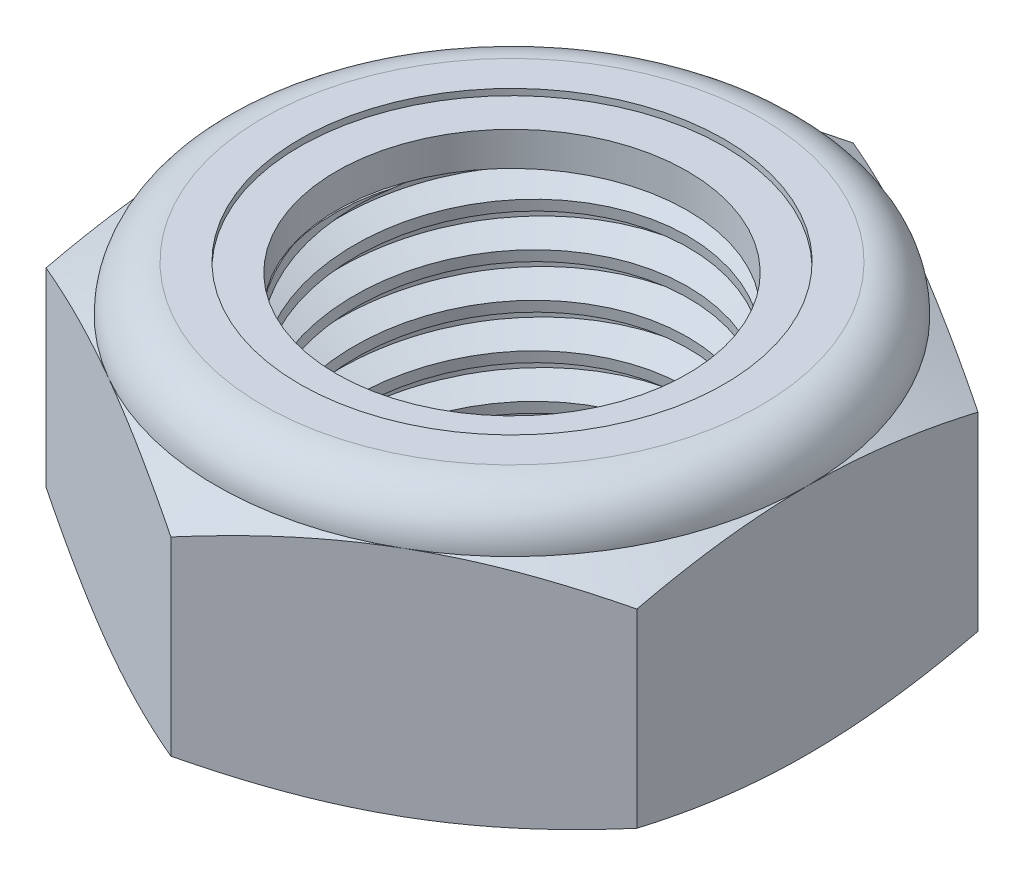
from build123d import *

# Parameters (mm, degrees)
EXTRUDE1_DEPTH       = 6.746875
SKETCH2_W            = 4.7625
SKETCH2_H            = 6.746875
LPATTERN1_COUNT      = 6
LPATTERN1_PITCH      = 1.058333333
LPATTERN1_COUNT_DIR2 = 2
LPATTERN1_PITCH_DIR2 = 1.058333333


with BuildPart() as part:
    # Sketch1 → Extrude1 (new body)
    with BuildSketch(Plane(origin=(0, 0, 0), x_dir=(1, 0, 0), z_dir=(0, 1, 0))):
        Polygon((0, 8.248891971), (-7.14375, 4.124445986), (-7.14375, -4.124445986), (0, -8.248891971), (7.14375, -4.124445986), (7.14375, 4.124445986), align=None)
    extrude(amount=EXTRUDE1_DEPTH)

    # Sketch4 → Cut-Revolve2 (revolve, cut)
    with BuildSketch(Plane(origin=(0, 0, 0), x_dir=(0, 0, -1), z_dir=(1, 0, 0))):
        Polygon((0, 6.746875), (4.7625, 6.746875), (4.244296017, 6.505232514), (4.244296017, 0.241642486), (4.7625, 0), (0, 0), align=None)
    revolve(axis=Axis((0, 6.746875, 0), (0, 1, 0)), mode=Mode.SUBTRACT)


with BuildPart() as body_2:
    # Sketch2 → Revolve1 (revolve)
    with BuildSketch(Plane(origin=(0, 0, 0), x_dir=(0, 0, -1), z_dir=(1, 0, 0))):
        with Locations((2.38125, 3.3734375)):
            Rectangle(SKETCH2_W, SKETCH2_H)
    revolve(axis=Axis((0, -4.7625, 0), (0, 1, 0)))

    # Sketch3 → Cut-Revolve1 (revolve, cut)
    with BuildSketch(Plane(origin=(0, 0, 0), x_dir=(0, 0, -1), z_dir=(1, 0, 0))):
        Polygon((4.777109171, 6.615392464), (4.879373365, 5.695014714), (4.273514358, 5.960461489), (4.244296017, 6.22342656), align=None)
    cut_revolve1 = revolve(axis=Axis((0, 6.746875, 0.125349185), (0, -0.9938837346736189, -0.11043152607484667)), mode=Mode.SUBTRACT)

    # LPattern1: Cut-Revolve1 6 × 2
    with Locations(*[Vector(0, -1, 0) * (i * LPATTERN1_PITCH) + Vector(0, 1, 0) * (j * LPATTERN1_PITCH_DIR2) for i in range(LPATTERN1_COUNT) for j in range(LPATTERN1_COUNT_DIR2) if (i, j) != (0, 0)]):
        add(cut_revolve1, mode=Mode.SUBTRACT)


with BuildPart() as part_1:
    add(part.part)

    # Combine1: cut body 2
    add(body_2.part, mode=Mode.SUBTRACT)

    # Sketch5 → Cut-Revolve3 (revolve, cut)
    with BuildSketch(Plane(origin=(0, 0, 0), x_dir=(0, 0, -1), z_dir=(1, 0, 0))):
        with BuildLine():
            Line((0, 0), (7.14375, 0))
            Line((7.14375, 0), (8.248891971, 0.515336164))
            Line((8.248891971, 0.515336164), (8.248891971, 5.107059669))
            Line((8.248891971, 5.107059669), (7.14375, 5.622395833))
            ThreePointArc((7.14375, 5.622395833), (6.814397677, 6.417522677), (6.019270833, 6.746875))
            Line((6.019270833, 6.746875), (6.019270833, 8.016875))
            Line((6.019270833, 8.016875), (9.518891971, 8.016875))
            Line((9.518891971, 8.016875), (9.518891971, -1.27))
            Line((9.518891971, -1.27), (0, -1.27))
            Line((0, -1.27), (0, 0))
        make_face()
    revolve(axis=Axis((0, 0, 0), (0, 1, 0)), mode=Mode.SUBTRACT)

    # Sketch6 → Cut-Revolve4 (revolve, cut)
    with BuildSketch(Plane(origin=(0, 0, 0), x_dir=(0, 0, -1), z_dir=(1, 0, 0))):
        with BuildLine():
            Line((0, 5.622395833), (6.99135, 5.622395833))
            ThreePointArc((6.99135, 5.622395833), (6.706634604, 6.309759604), (6.019270833, 6.594475))
            Line((6.019270833, 6.594475), (5.131783425, 6.594475))
            Line((5.131783425, 6.594475), (5.131783425, 8.016875))
            Line((5.131783425, 8.016875), (0, 8.016875))
            Line((0, 8.016875), (0, 5.622395833))
        make_face()
    revolve(axis=Axis((0, 8.016875, 0), (0, 1, 0)), mode=Mode.SUBTRACT)


with BuildPart() as body_2_2:
    # Sketch7 → Revolve2 (revolve)
    with BuildSketch(Plane(origin=(0, 0, 0), x_dir=(0, 0, -1), z_dir=(1, 0, 0))):
        with BuildLine():
            Line((4.244296017, 5.698595833), (6.91190348, 5.698595833))
            ThreePointArc((6.91190348, 5.698595833), (6.625213689, 6.282269107), (6.019270833, 6.518275))
            Line((6.019270833, 6.518275), (4.244296017, 6.518275))
            Line((4.244296017, 6.518275), (4.244296017, 5.698595833))
        make_face()
    revolve(axis=Axis((0, 5.698595833, 0), (0, 1, 0)))


solid = Compound([part_1.part, body_2_2.part])
